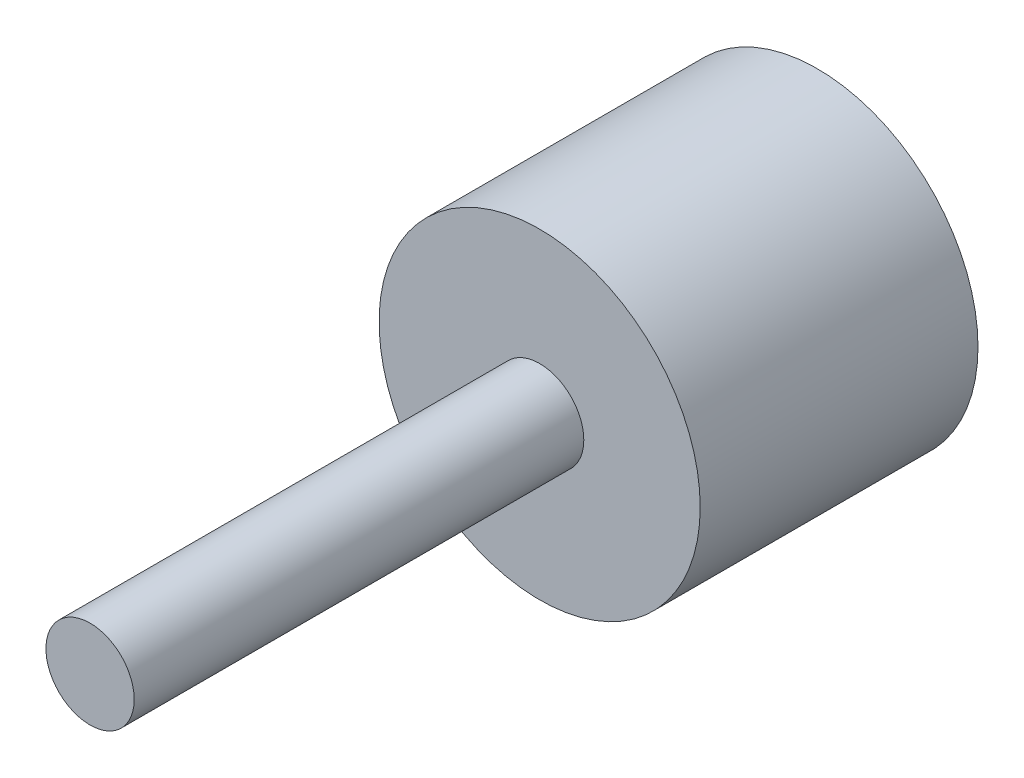
from build123d import *

# Parameters (mm, degrees)
ESQUISSE1_R        = 10
BOSS_EXTRU_1_DEPTH = 17.3
ESQUISSE2_R        = 2.75
BOSS_EXTRU_2_DEPTH = 28
ESQUISSE3_R        = 6
BOSS_EXTRU_3_DEPTH = 2.7
CONG_2_R           = 6


with BuildPart() as part:
    # Esquisse1 → Boss.-Extru.1 (new body)
    with BuildSketch(Plane.XY):
        Circle(ESQUISSE1_R)
    extrude(amount=BOSS_EXTRU_1_DEPTH)

    # Esquisse2 → Boss.-Extru.2 (add)
    with BuildSketch(Plane.XY.offset(17.3)):
        Circle(ESQUISSE2_R)
    extrude(amount=BOSS_EXTRU_2_DEPTH)

    # Esquisse3 → Boss.-Extru.3 (add)
    with BuildSketch(Plane(origin=(0, 0, 0), x_dir=(-1, 0, 0), z_dir=(0, 0, -1))):
        with Locations(Location((0, 0, 0), (0, 0, 180))):
            Circle(ESQUISSE3_R)
    extrude(amount=BOSS_EXTRU_3_DEPTH)

    # Congé2
    # the kernel refuses this fillet: 6 mm, written as the material it takes off along each edge
    with BuildSketch(Plane(origin=(0, 0, -2.7), x_dir=(1, 0, 0), z_dir=(0, 1, 0))) as cong_2_piece_1:
        with BuildLine():
            CenterArc((0.989012073, -6), CONG_2_R, 33.367012969, 56.632987031)
            Line((0.989012073, 0), (0.989012073, 0.12))
            Line((0.989012073, 0.12), (6, 0.12))
            Line((6, 0.12), (6.12, 0))
            ThreePointArc((6.12, 0), (6.12, -1.35), (6.100219759, -2.634))
            Line((6.100219759, -2.634), (6, -2.7))
        make_face()
    revolve(axis=Axis((0, 0, -2.7), (0, 0, -1)), mode=Mode.SUBTRACT)


solid = part.part
